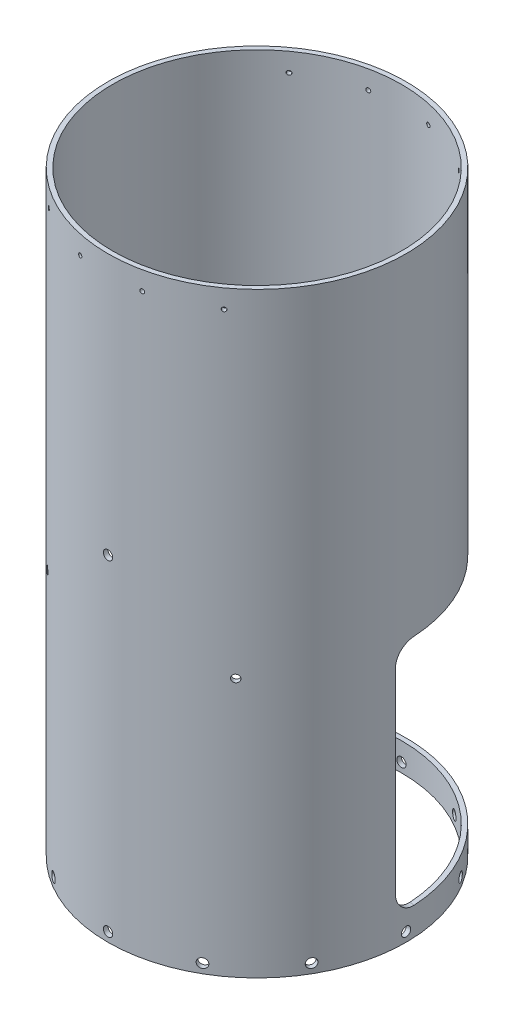
from build123d import *

# Parameters (mm, degrees)
SKETCH1_R                    = 101.6
SKETCH1_R_2                  = 98.425
BOSS_EXTRUDE1_DEPTH          = 406.4
CUT_EXTRUDE2_START           = 19.05
CUT_EXTRUDE2_DEPTH           = 158.75
FILLET1_R                    = 12.7
SKETCH4_R                    = 1.4224
SHEAR_PIN_HOLE_DEPTH         = 35.56
SKETCH5_R                    = 3.175
BULKHEAD_HOLES_DEPTH         = 35.56
BULKHEAD_CIRC_PATTERN_COUNT  = 12
SKETCH9_R                    = 2.54
DROGUE_POD_VENT_HOLE_1_DEPTH = 35.56
SKETCH10_R                   = 2.54
DROGUE_POD_VENT_HOLE_2_DEPTH = 35.56
SKETCH11_R                   = 3.175
VENT_HOLES_DEPTH             = 466.58969076


with BuildPart() as part:
    # Sketch1 → Boss-Extrude1 (new body)
    with BuildSketch(Plane(origin=(0, 0, 0), x_dir=(1, 0, 0), z_dir=(0, 1, 0))):
        with Locations(Location((0, 0, 0), (0, 0, 270))):
            Circle(SKETCH1_R)
        with Locations(Location((0, 0, 0), (0, 0, 270))):
            Circle(SKETCH1_R_2, mode=Mode.SUBTRACT)
    extrude(amount=BOSS_EXTRUDE1_DEPTH)

    # Sketch3 → Cut-Extrude2 (cut)
    with BuildSketch(Plane(origin=(0, 0, 0), x_dir=(1, 0, 0), z_dir=(0, 1, 0)).offset(CUT_EXTRUDE2_START)):
        with BuildLine():
            Line((-101.352507506, -7.087257732), (-98.185241647, -6.865780928))
            ThreePointArc((-98.185241647, -6.865780928), (-71.983488082, 67.125688589), (0, 98.425))
            Line((0, 98.425), (0, 101.6))
            ThreePointArc((0, 101.6), (-74.305536085, 69.291033382), (-101.352507506, -7.087257732))
        make_face()
        with BuildLine():
            ThreePointArc((98.425, 0), (98.365042149, -3.434982963), (98.185241647, -6.865780928))
            Line((98.185241647, -6.865780928), (101.352507506, -7.087257732))
            ThreePointArc((101.352507506, -7.087257732), (101.538108025, -3.545788865), (101.6, 0))
            ThreePointArc((101.6, 0), (71.842048969, 71.842048969), (0, 101.6))
            Line((0, 101.6), (0, 98.425))
            ThreePointArc((0, 98.425), (69.596984938, 69.596984938), (98.425, 0))
        make_face()
    extrude(amount=CUT_EXTRUDE2_DEPTH, mode=Mode.SUBTRACT)

    # Fillet1
    fillet1_edges = [part.edges().sort_by_distance(p)[0] for p in [
        (99.768874577, 19.05, 6.97651933),
        (-99.768874577, 177.8, 6.97651933),
        (99.768874577, 177.8, 6.97651933),
        (-99.768874577, 19.05, 6.97651933),
    ]]
    fillet(fillet1_edges, radius=FILLET1_R)

    # Sketch4 → Shear Pin Hole (cut)
    with BuildSketch(Plane(origin=(21.123827787, 0, -99.379796235), x_dir=(0.9781476007338056, 0, 0.2079116908177598), z_dir=(-0.2079116908177598, 0, 0.9781476007338056))):
        with Locations(Location((0, 393.7, 0), (0, 0, 180))):
            Circle(SKETCH4_R)
    shear_pin_hole = extrude(amount=SHEAR_PIN_HOLE_DEPTH, mode=Mode.SUBTRACT)

    # Shear Pin Pattern: read off the stored shape, not the designer's step
    # Shear Pin Pattern: loft between two sections, ruled curve by curve
    shear_pin_pattern_from = [
        Edge.make_three_point_arc((-21.852887143, 393.7, -95.968384698), (-20.461569995, 395.1224, -96.264118287), (-19.070252848, 393.7, -96.559851876)),
        Edge.make_three_point_arc((-19.070252848, 393.7, -96.559851876), (-20.461569995, 392.2776, -96.264118287), (-21.852887143, 393.7, -95.968384698)),
    ]
    shear_pin_pattern_to = [
        Edge.make_three_point_arc((-22.515144936, 393.7, -99.084062652), (-21.123827788, 395.1224, -99.379796241), (-19.732510641, 393.7, -99.67552983)),
        Edge.make_three_point_arc((-19.732510641, 393.7, -99.67552983), (-21.123827788, 392.2776, -99.379796241), (-22.515144936, 393.7, -99.084062652)),
    ]
    shear_pin_pattern = Solid(Shell([*[Face.make_surface_from_curves(shear_pin_pattern_from[k], shear_pin_pattern_to[k]) for k in range(2)], Face(Wire(shear_pin_pattern_from)), Face(Wire(shear_pin_pattern_to))]))
    add(shear_pin_pattern, mode=Mode.SUBTRACT)

    # Shear Pin Pattern 2: loft between two sections, ruled curve by curve
    shear_pin_pattern_2_from = [
        Edge.make_three_point_arc((-58.997464419, 393.7, -78.78311196), (-57.846718646, 395.1224, -79.619177703), (-56.695972873, 393.7, -80.455243446)),
        Edge.make_three_point_arc((-56.695972873, 393.7, -80.455243446), (-57.846718646, 392.2776, -79.619177703), (-58.997464419, 393.7, -78.78311196)),
    ]
    shear_pin_pattern_2_to = [
        Edge.make_three_point_arc((-60.86972741, 393.7, -81.360060891), (-59.718981637, 395.1224, -82.196126634), (-58.568235864, 393.7, -83.032192377)),
        Edge.make_three_point_arc((-58.568235864, 393.7, -83.032192377), (-59.718981637, 392.2776, -82.196126634), (-60.86972741, 393.7, -81.360060891)),
    ]
    shear_pin_pattern_2 = Solid(Shell([*[Face.make_surface_from_curves(shear_pin_pattern_2_from[k], shear_pin_pattern_2_to[k]) for k in range(2)], Face(Wire(shear_pin_pattern_2_from)), Face(Wire(shear_pin_pattern_2_to))]))
    add(shear_pin_pattern_2, mode=Mode.SUBTRACT)

    # Shear Pin Pattern 3: loft between two sections, ruled curve by curve
    shear_pin_pattern_3_from = [
        Edge.make_three_point_arc((56.695972873, 393.7, -80.455243446), (57.846718646, 395.1224, -79.619177703), (58.997464419, 393.7, -78.78311196)),
        Edge.make_three_point_arc((58.997464419, 393.7, -78.78311196), (57.846718646, 392.2776, -79.619177703), (56.695972873, 393.7, -80.455243446)),
    ]
    shear_pin_pattern_3_to = [
        Edge.make_three_point_arc((58.568235864, 393.7, -83.032192377), (59.718981637, 395.1224, -82.196126634), (60.86972741, 393.7, -81.360060891)),
        Edge.make_three_point_arc((60.86972741, 393.7, -81.360060891), (59.718981637, 392.2776, -82.196126634), (58.568235864, 393.7, -83.032192377)),
    ]
    shear_pin_pattern_3 = Solid(Shell([*[Face.make_surface_from_curves(shear_pin_pattern_3_from[k], shear_pin_pattern_3_to[k]) for k in range(2)], Face(Wire(shear_pin_pattern_3_from)), Face(Wire(shear_pin_pattern_3_to))]))
    add(shear_pin_pattern_3, mode=Mode.SUBTRACT)

    # Shear Pin Mirror: Shear Pin Hole, Shear Pin Pattern, Shear Pin Pattern 2, Shear Pin Pattern 3 across plane
    add(shear_pin_hole.mirror(Plane.XY), mode=Mode.SUBTRACT)
    add(shear_pin_pattern.mirror(Plane.XY), mode=Mode.SUBTRACT)
    add(shear_pin_pattern_2.mirror(Plane.XY), mode=Mode.SUBTRACT)
    add(shear_pin_pattern_3.mirror(Plane.XY), mode=Mode.SUBTRACT)

    # Sketch5 → Bulkhead Holes (cut)
    with BuildSketch(Plane(origin=(0, 0, -101.6), x_dir=(-1, 0, 0), z_dir=(0, 0, -1))):
        with Locations(Location((0, 6.35, 0), (0, 0, 90))):
            Circle(SKETCH5_R)
    bulkhead_holes = extrude(amount=-BULKHEAD_HOLES_DEPTH, mode=Mode.SUBTRACT)

    # Bulkhead Circ Pattern: Bulkhead Holes ×12 about axis
    bulkhead_circ_pattern_axis = Axis((0, 406.4, 0), (0, -1, 0))
    for i in range(1, BULKHEAD_CIRC_PATTERN_COUNT):
        add(bulkhead_holes.rotate(bulkhead_circ_pattern_axis, i * 360 / BULKHEAD_CIRC_PATTERN_COUNT), mode=Mode.SUBTRACT)

    # Sketch9 → Drogue Pod Vent Hole 1 (cut)
    with BuildSketch(Plane(origin=(64.200712258, 0, 78.745339834), x_dir=(0.7750525574203261, 0, -0.6318967741935483), z_dir=(0.6318967741935483, 0, 0.7750525574203261))):
        with Locations((0, 176.3776)):
            Circle(SKETCH9_R)
    extrude(amount=-DROGUE_POD_VENT_HOLE_1_DEPTH, mode=Mode.SUBTRACT)

    # Sketch10 → Drogue Pod Vent Hole 2 (cut)
    with BuildSketch(Plane(origin=(-64.200712258, 0, 78.745339834), x_dir=(0.7750525574203261, 0, 0.6318967741935483), z_dir=(-0.6318967741935483, 0, 0.7750525574203261))):
        with Locations((0, 176.3776)):
            Circle(SKETCH10_R)
    extrude(amount=-DROGUE_POD_VENT_HOLE_2_DEPTH, mode=Mode.SUBTRACT)

    # Sketch11 → Vent Holes (cut, through all)
    with BuildSketch(Plane.XY.offset(101.6)):
        with Locations((0, 228.6)):
            Circle(SKETCH11_R)
    extrude(amount=-VENT_HOLES_DEPTH, mode=Mode.SUBTRACT)


solid = part.part
